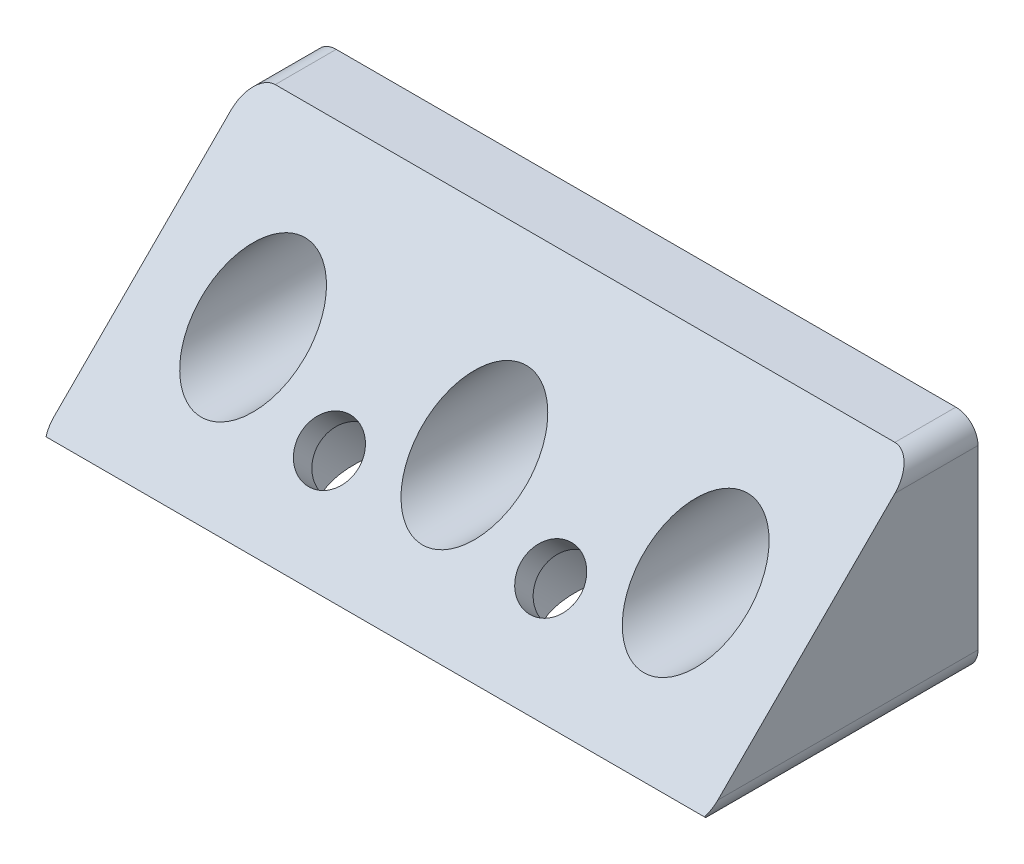
from build123d import *

# Parameters (mm, degrees)
SKETCH3_W                                        = 76.2
SKETCH3_H                                        = 25.4
BOSS_EXTRUDE1_DEPTH                              = 31.75
CBORE_FOR_1_4_BUTTON_HEAD_CAP_SCREW1_D           = 6.7564
CBORE_FOR_1_4_BUTTON_HEAD_CAP_SCREW1_CBORE_D     = 11.90752
CBORE_FOR_1_4_BUTTON_HEAD_CAP_SCREW1_CBORE_DEPTH = 28.7528
CUT_EXTRUDE1_START                               = -76.2
CUT_EXTRUDE1_DEPTH                               = 76.2
CBORE_FOR_1_4_BUTTON_HEAD_CAP_SCREW2_D           = 6.7564
CBORE_FOR_1_4_BUTTON_HEAD_CAP_SCREW2_CBORE_D     = 11.90752
CBORE_FOR_1_4_BUTTON_HEAD_CAP_SCREW2_CBORE_DEPTH = 22.4028
FILLET1_R                                        = 2.54


# Read off the part's stored shape, not the designer's step: Cut-Extrude1
with BuildPart() as part:
    # Sketch3 → Boss-Extrude1 (new body)
    with BuildSketch(Plane.XY):
        with Locations((38.1, 12.7)):
            Rectangle(SKETCH3_W, SKETCH3_H)
    extrude(amount=BOSS_EXTRUDE1_DEPTH)

    # CBORE for 1/4 Button Head Cap Screw1 (through all)
    with Locations(Plane.XY.offset(31.75)):
        with Locations((12.7, 12.7), (38.1, 12.7), (63.5, 12.7)):
            CounterBoreHole(CBORE_FOR_1_4_BUTTON_HEAD_CAP_SCREW1_D / 2, CBORE_FOR_1_4_BUTTON_HEAD_CAP_SCREW1_CBORE_D / 2, CBORE_FOR_1_4_BUTTON_HEAD_CAP_SCREW1_CBORE_DEPTH)

    # Cut-Extrude1 outline → Cut-Extrude1 (cut)
    with BuildSketch(Plane(origin=(76.2, 0, 0), x_dir=(0, 0, -1), z_dir=(1, 0, 0)).offset(CUT_EXTRUDE1_START)):
        Polygon((-31.75, 0), (-29.761484683, 0), (-31.080742341, 1.319257659), (-7, 25.4), (-31.75, 25.4), align=None)
    extrude(amount=CUT_EXTRUDE1_DEPTH, mode=Mode.SUBTRACT)

    # CBORE for 1/4 Button Head Cap Screw2 (through all)
    with Locations(Plane(origin=(0, -1.760512242, -1.760512242), x_dir=(1, 0, 0), z_dir=(0, -0.7071067811865437, -0.7071067811865513))):
        with Locations((25.4, 10.522273819), (50.8, 10.522273819)):
            CounterBoreHole(CBORE_FOR_1_4_BUTTON_HEAD_CAP_SCREW2_D / 2, CBORE_FOR_1_4_BUTTON_HEAD_CAP_SCREW2_CBORE_D / 2, CBORE_FOR_1_4_BUTTON_HEAD_CAP_SCREW2_CBORE_DEPTH)

    # Fillet1
    fillet1_edges = [part.edges().sort_by_distance(p)[0] for p in [
        (0, 0, 14.880742341),
        (0, 25.4, 3.5),
        (76.2, 25.4, 3.5),
        (76.2, 0, 14.880742341),
    ]]
    fillet(fillet1_edges, radius=FILLET1_R)


solid = part.part
